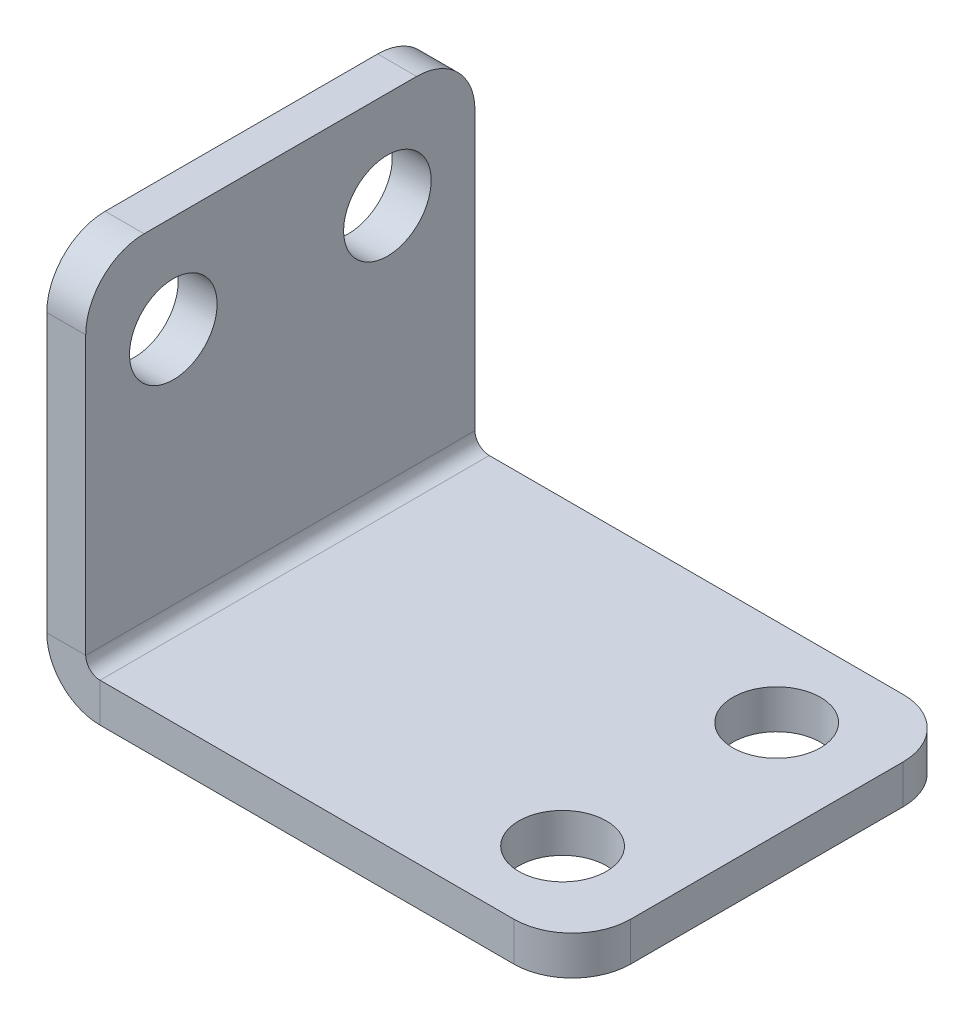
from build123d import *

# Parameters (mm, degrees)
SM_BASE_FLANGE_1_DEPTH = 10
SKETCH_3_R             = 2.25
CUT_EXTRUDE_1_DEPTH    = 34.541019662
SKETCH_4_R             = 2.25
CUT_EXTRUDE_2_DEPTH    = 34.955853693
FILLET_1_R             = 3


# Sheet-metal steps are written as plain solids
with BuildPart() as part:
    # Sketch 1 → 基体-法兰1 (new, symmetric)
    with BuildSketch(Plane.XY):
        with BuildLine():
            Line((0, 20), (0, 2.7366))
            ThreePointArc((0, 2.7366), (0.801531583, 0.801531583), (2.7366, 0))
            Line((2.7366, 0), (27, 0))
            Line((27, 0), (27, 2))
            Line((27, 2), (2.7366, 2))
            ThreePointArc((2.7366, 2), (2.215745145, 2.215745145), (2, 2.7366))
            Line((2, 2.7366), (2, 20))
            Line((2, 20), (0, 20))
        make_face()
    extrude(amount=SM_BASE_FLANGE_1_DEPTH, both=True)

    # 草图3 → 切除-拉伸1 (cut, through all)
    with BuildSketch(Plane(origin=(2, 0, 0), x_dir=(0, 0, -1), z_dir=(1, 0, 0))):
        with Locations(Location((-5.5, 15, 0), (0, 0, 90))):
            Circle(SKETCH_3_R)
        with Locations(Location((5.5, 15, 0), (0, 0, 270))):
            Circle(SKETCH_3_R)
    extrude(amount=-CUT_EXTRUDE_1_DEPTH, mode=Mode.SUBTRACT)

    # 草图4 → 切除-拉伸2 (cut, through all)
    with BuildSketch(Plane(origin=(0, 2, 0), x_dir=(1, 0, 0), z_dir=(0, 1, 0))):
        with Locations(Location((22, 5.5, 0), (0, 0, 270))):
            Circle(SKETCH_4_R)
        with Locations(Location((22, -5.5, 0), (0, 0, 90))):
            Circle(SKETCH_4_R)
    extrude(amount=-CUT_EXTRUDE_2_DEPTH, mode=Mode.SUBTRACT)

    # 圆角1
    fillet_1_edges = [part.edges().sort_by_distance(p)[0] for p in [
        (1, 20, 10),
        (27, 1, 10),
        (1, 20, -10),
        (27, 1, -10),
    ]]
    fillet(fillet_1_edges, radius=FILLET_1_R)


solid = part.part
